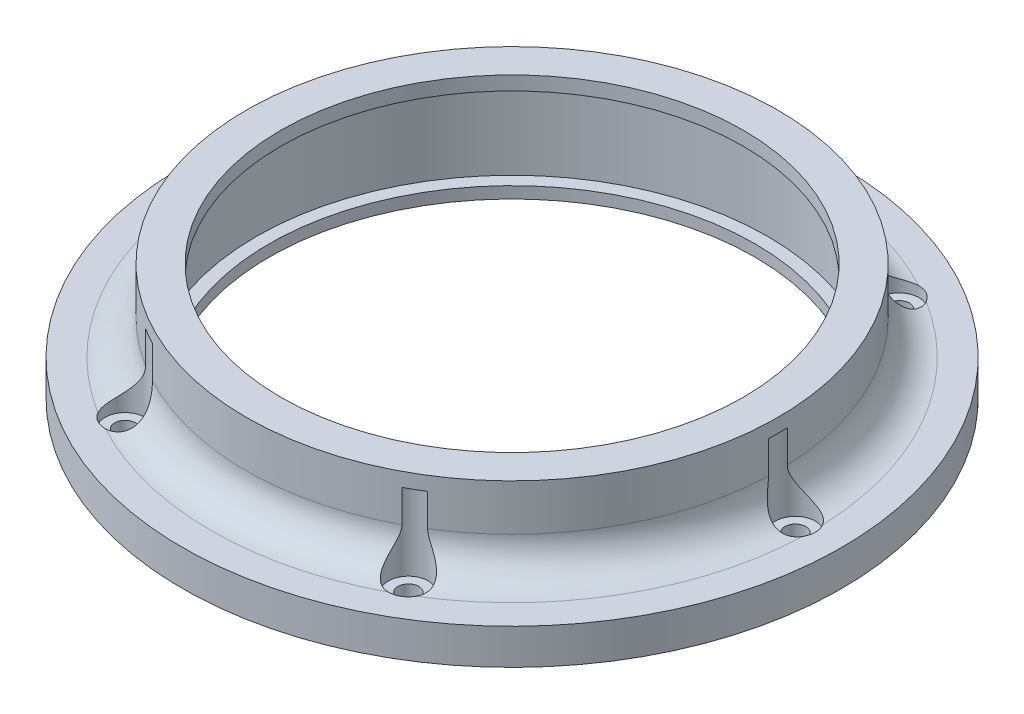
from build123d import *

# Parameters (mm, degrees)
SKETCH1_R           = 57.5
SKETCH1_R_2         = 55.25
BOSS_EXTRUDE1_DEPTH = 22
SKETCH2_R           = 71.25
SKETCH2_R_2         = 57.5
BOSS_EXTRUDE2_DEPTH = 7.5
FILLET2_R           = 7.5
SKETCH7_R           = 4.3
CUT_EXTRUDE1_DEPTH  = 102.800663063
CIRPATTERN1_COUNT   = 6
SKETCH8_R           = 52.5
BOSS_EXTRUDE3_DEPTH = 2.5
SKETCH10_R          = 71.25
SKETCH10_R_2        = 55.25
SKETCH10_R_3        = 2.25
BOSS_EXTRUDE4_DEPTH = 0.2
SKETCH11_R          = 57.5
SKETCH11_R_2        = 50
BOSS_EXTRUDE5_DEPTH = 3


with BuildPart() as part:
    # Sketch1 → Boss-Extrude1 (new body)
    with BuildSketch(Plane(origin=(0, 0, 0), x_dir=(1, 0, 0), z_dir=(0, 1, 0))):
        with Locations(Location((0, 0, 0), (0, 0, 270))):
            Circle(SKETCH1_R)
        with Locations(Location((0, 0, 0), (0, 0, 270))):
            Circle(SKETCH1_R_2, mode=Mode.SUBTRACT)
    extrude(amount=BOSS_EXTRUDE1_DEPTH)

    # Sketch2 → Boss-Extrude2 (add)
    with BuildSketch(Plane.XZ):
        with Locations(Location((0, 0, 0), (0, 0, 270))):
            Circle(SKETCH2_R)
        with Locations(Location((0, 0, 0), (0, 0, 270))):
            Circle(SKETCH2_R_2, mode=Mode.SUBTRACT)
    extrude(amount=-BOSS_EXTRUDE2_DEPTH)

    # Sketch5 → CBORE for M4 SBHCS1 (revolve, cut)
    with BuildSketch(Plane(origin=(-61.25, 7.5, 0), x_dir=(0, 0, 1), z_dir=(1, 0, 0))):
        Polygon((0, 0), (0, 7.5), (2.25, 7.5), (2.25, 2.2), (4.3, 2.2), (4.3, 0), align=None)
    cbore_for_m4_sbhcs1 = revolve(axis=Axis((-61.25, 13.85, 0), (0, -1, 0)), mode=Mode.SUBTRACT)

    # Fillet2
    # the kernel refuses this fillet: 7.5 mm, written as the material it adds along each edge
    with BuildSketch(Plane(origin=(0, 7.5, 0), x_dir=(0, 0, 1), z_dir=(-1, 0, 0))) as fillet2_piece_1_section:
        with BuildLine():
            CenterArc((57.5 + FILLET2_R, FILLET2_R), FILLET2_R, 180, 90)
            Line((57.5 + FILLET2_R, 0), (57.5, 0))
            Line((57.5, 0), (57.5, FILLET2_R))
        make_face()
    fillet2_piece_1 = revolve(axis=Axis((0, 7.5, 0), (0, 1, 0)), revolution_arc=286.71849096, mode=Mode.PRIVATE)
    fillet2_piece_1 = fillet2_piece_1 - Plane(origin=(-61.25, 9.591155596, 0), x_dir=(0, 0, 1), z_dir=(0, 1, 0)) * Cylinder(4.3, 260, mode=Mode.PRIVATE)
    add(fillet2_piece_1)
    with BuildSketch(Plane(origin=(0, 7.5, 0), x_dir=(-0.9580279860671848, 0, -0.2866746900444024), z_dir=(0.2866746900444024, 0, -0.9580279860671848))) as fillet2_piece_2_section:
        with BuildLine():
            CenterArc((57.5 + FILLET2_R, FILLET2_R), FILLET2_R, 180, 90)
            Line((57.5 + FILLET2_R, 0), (57.5, 0))
            Line((57.5, 0), (57.5, FILLET2_R))
        make_face()
    fillet2_piece_2 = revolve(axis=Axis((0, 7.5, 0), (0, 1, 0)), revolution_arc=106.658978895, mode=Mode.PRIVATE)
    fillet2_piece_2 = fillet2_piece_2 - Plane(origin=(-61.25, 9.194240461, 0), x_dir=(0, 0, 1), z_dir=(0, 1, 0)) * Cylinder(4.3, 261, mode=Mode.PRIVATE)
    add(fillet2_piece_2)

    # Sketch7 → Cut-Extrude1 (cut, through all)
    with BuildSketch(Plane(origin=(0, 7.5, 0), x_dir=(1, 0, 0), z_dir=(0, 1, 0))):
        with Locations(Location((-61.25, 0, 0), (0, 0, 270))):
            Circle(SKETCH7_R)
    cut_extrude1 = extrude(amount=CUT_EXTRUDE1_DEPTH, mode=Mode.SUBTRACT)

    # CirPattern1: CBORE for M4 SBHCS1, Cut-Extrude1 ×6 about axis
    cirpattern1_axis = Axis((0, 0, 0), (0, 1, 0))
    add([cbore_for_m4_sbhcs1.rotate(cirpattern1_axis, i * 360 / CIRPATTERN1_COUNT) for i in range(1, CIRPATTERN1_COUNT)], mode=Mode.SUBTRACT)
    add([cut_extrude1.rotate(cirpattern1_axis, i * 360 / CIRPATTERN1_COUNT) for i in range(1, CIRPATTERN1_COUNT)], mode=Mode.SUBTRACT)

    # Sketch8 → Boss-Extrude3 (add)
    with BuildSketch(Plane(origin=(0, 0, 0), x_dir=(1, 0, 0), z_dir=(0, 1, 0))):
        with BuildLine():
            ThreePointArc((-57.463857143, -2.038411702), (-49.796460718, -28.75), (-30.497244888, -48.745954234))
            ThreePointArc((-30.497244888, -48.745954234), (-28.475, -49.320146746), (-26.966612254, -50.784365936))
            ThreePointArc((-26.966612254, -50.784365936), (0, -57.5), (26.966612254, -50.784365936))
            ThreePointArc((26.966612254, -50.784365936), (28.475, -49.320146746), (30.497244888, -48.745954234))
            ThreePointArc((30.497244888, -48.745954234), (49.796460718, -28.75), (57.463857143, -2.038411702))
            ThreePointArc((57.463857143, -2.038411702), (56.95, 0), (57.463857143, 2.038411702))
            ThreePointArc((57.463857143, 2.038411702), (49.796460718, 28.75), (30.497244888, 48.745954234))
            ThreePointArc((30.497244888, 48.745954234), (28.475, 49.320146746), (26.966612254, 50.784365936))
            ThreePointArc((26.966612254, 50.784365936), (0, 57.5), (-26.966612254, 50.784365936))
            ThreePointArc((-26.966612254, 50.784365936), (-28.475, 49.320146746), (-30.497244888, 48.745954234))
            ThreePointArc((-30.497244888, 48.745954234), (-49.796460718, 28.75), (-57.463857143, 2.038411702))
            ThreePointArc((-57.463857143, 2.038411702), (-56.95, 0), (-57.463857143, -2.038411702))
        make_face()
        with Locations(Location((0, 0, 0), (0, 0, 270))):
            Circle(SKETCH8_R, mode=Mode.SUBTRACT)
    extrude(amount=BOSS_EXTRUDE3_DEPTH)

    # Sketch10 → Boss-Extrude4 (add)
    with BuildSketch(Plane.XZ):
        with Locations(Location((0, 0, 0), (0, 0, 270))):
            Circle(SKETCH10_R)
        with Locations(Location((0, 0, 0), (0, 0, 90))):
            Circle(SKETCH10_R_2, mode=Mode.SUBTRACT)
        with Locations(Location((61.25, 0, 0), (0, 0, 90))):
            Circle(SKETCH10_R_3, mode=Mode.SUBTRACT)
        with Locations(Location((30.625, 53.044055982, 0), (0, 0, 90))):
            Circle(SKETCH10_R_3, mode=Mode.SUBTRACT)
        with Locations(Location((-30.625, 53.044055982, 0), (0, 0, 90))):
            Circle(SKETCH10_R_3, mode=Mode.SUBTRACT)
        with Locations(Location((-61.25, 0, 0), (0, 0, 90))):
            Circle(SKETCH10_R_3, mode=Mode.SUBTRACT)
        with Locations(Location((-30.625, -53.044055982, 0), (0, 0, 90))):
            Circle(SKETCH10_R_3, mode=Mode.SUBTRACT)
        with Locations(Location((30.625, -53.044055982, 0), (0, 0, 90))):
            Circle(SKETCH10_R_3, mode=Mode.SUBTRACT)
    extrude(amount=BOSS_EXTRUDE4_DEPTH)

    # Sketch11 → Boss-Extrude5 (add)
    with BuildSketch(Plane(origin=(0, 22, 0), x_dir=(1, 0, 0), z_dir=(0, 1, 0))):
        with Locations(Location((0, 0, 0), (0, 0, 117.968402359))):
            Circle(SKETCH11_R)
        with Locations(Location((0, 0, 0), (0, 0, 270))):
            Circle(SKETCH11_R_2, mode=Mode.SUBTRACT)
    extrude(amount=BOSS_EXTRUDE5_DEPTH)


solid = part.part
